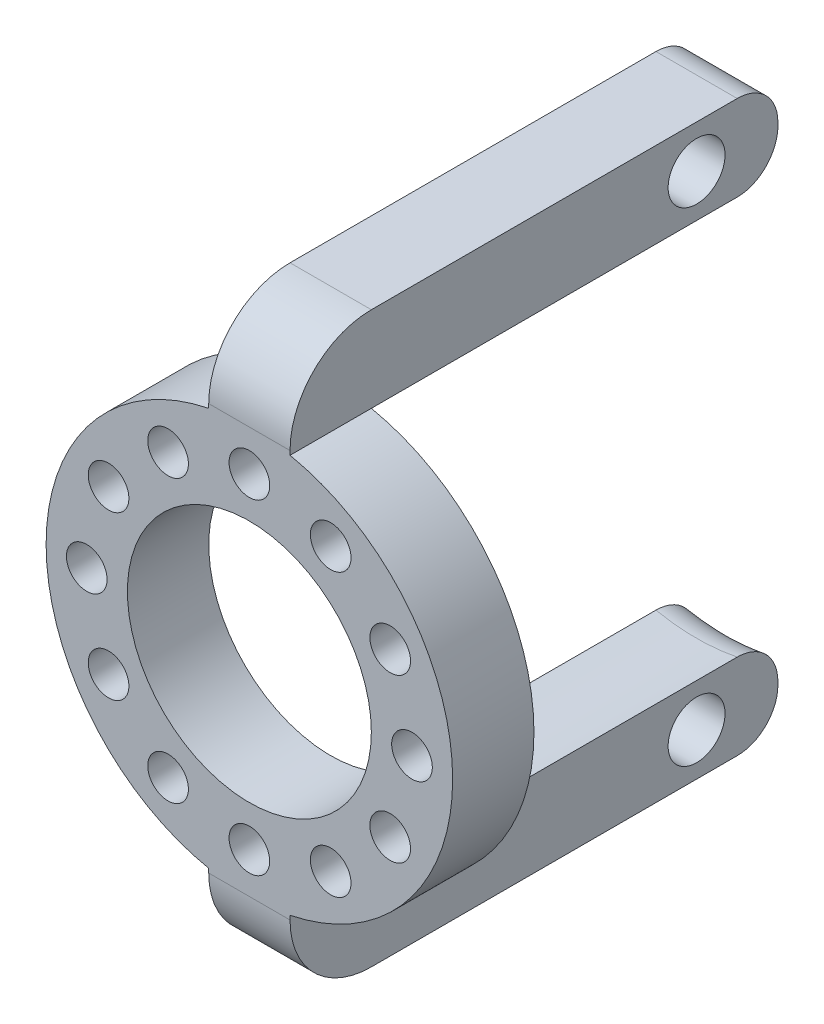
from build123d import *

# Parameters (mm, degrees)
SKETCH1_R           = 12.5
SKETCH1_R_2         = 7.5
BOSS_EXTRUDE1_DEPTH = 5
SKETCH3_R           = 1.25
CUT_EXTRUDE1_DEPTH  = 5
BOSS_EXTRUDE2_START = -30
BOSS_EXTRUDE2_DEPTH = 30
SKETCH6_R           = 1.75
CUT_EXTRUDE2_DEPTH  = 35.003676272
FILLET1_R           = 5
FILLET2_R           = 2.5


with BuildPart() as part:
    # Sketch1 → Boss-Extrude1 (new body)
    with BuildSketch(Plane.XY):
        Circle(SKETCH1_R)
        Circle(SKETCH1_R_2, mode=Mode.SUBTRACT)
    extrude(amount=BOSS_EXTRUDE1_DEPTH)

    # Sketch3 → Cut-Extrude1 (cut)
    with BuildSketch(Plane.XY.offset(5)):
        with Locations((0, 10)):
            Circle(SKETCH3_R)
        with Locations((5, 8.660254038)):
            Circle(SKETCH3_R)
        with Locations((8.660254038, 5)):
            Circle(SKETCH3_R)
        with Locations((10, 0)):
            Circle(SKETCH3_R)
        with Locations((8.660254038, -5)):
            Circle(SKETCH3_R)
        with Locations((5, -8.660254038)):
            Circle(SKETCH3_R)
        with Locations((0, -10)):
            Circle(SKETCH3_R)
        with Locations((-5, -8.660254038)):
            Circle(SKETCH3_R)
        with Locations((-8.660254038, -5)):
            Circle(SKETCH3_R)
        with Locations((-10, 0)):
            Circle(SKETCH3_R)
        with Locations((-8.660254038, 5)):
            Circle(SKETCH3_R)
        with Locations((-5, 8.660254038)):
            Circle(SKETCH3_R)
    extrude(amount=-CUT_EXTRUDE1_DEPTH, mode=Mode.SUBTRACT)

    # Sketch4 → Boss-Extrude2 (add)
    with BuildSketch(Plane.XY.offset(5).offset(BOSS_EXTRUDE2_START)):
        with BuildLine():
            Line((-2.5, 17.5), (-2.5, 12.247448714))
            ThreePointArc((-2.5, 12.247448714), (0, 12.5), (2.5, 12.247448714))
            Line((2.5, 12.247448714), (2.5, 17.5))
            Line((2.5, 17.5), (-2.5, 17.5))
        make_face()
        with BuildLine():
            Line((-2.5, -12.247448714), (-2.5, -17.5))
            Line((-2.5, -17.5), (2.5, -17.5))
            Line((2.5, -17.5), (2.5, -12.247448714))
            ThreePointArc((2.5, -12.247448714), (0, -12.5), (-2.5, -12.247448714))
        make_face()
    extrude(amount=BOSS_EXTRUDE2_DEPTH)

    # Sketch6 → Cut-Extrude2 (cut, through all)
    with BuildSketch(Plane(origin=(2.5, 0, 0), x_dir=(0, 0, -1), z_dir=(1, 0, 0))):
        with Locations((20, 14.873724357)):
            Circle(SKETCH6_R)
        with Locations((20, -14.873724357)):
            Circle(SKETCH6_R)
    extrude(amount=-CUT_EXTRUDE2_DEPTH, mode=Mode.SUBTRACT)

    # Fillet1
    fillet1_edges = [part.edges().sort_by_distance(p)[0] for p in [
        (0, 17.5, 5),
        (0, -17.5, 5),
    ]]
    fillet(fillet1_edges, radius=FILLET1_R)

    # Fillet2
    fillet2_edges = [part.edges().sort_by_distance(p)[0] for p in [
        (0, 12.5, -25),
        (0, 17.5, -25),
        (0, -17.5, -25),
        (0, -12.5, -25),
    ]]
    fillet(fillet2_edges, radius=FILLET2_R - 0.0001)  # a hair under: the kernel refuses the full size


solid = part.part
